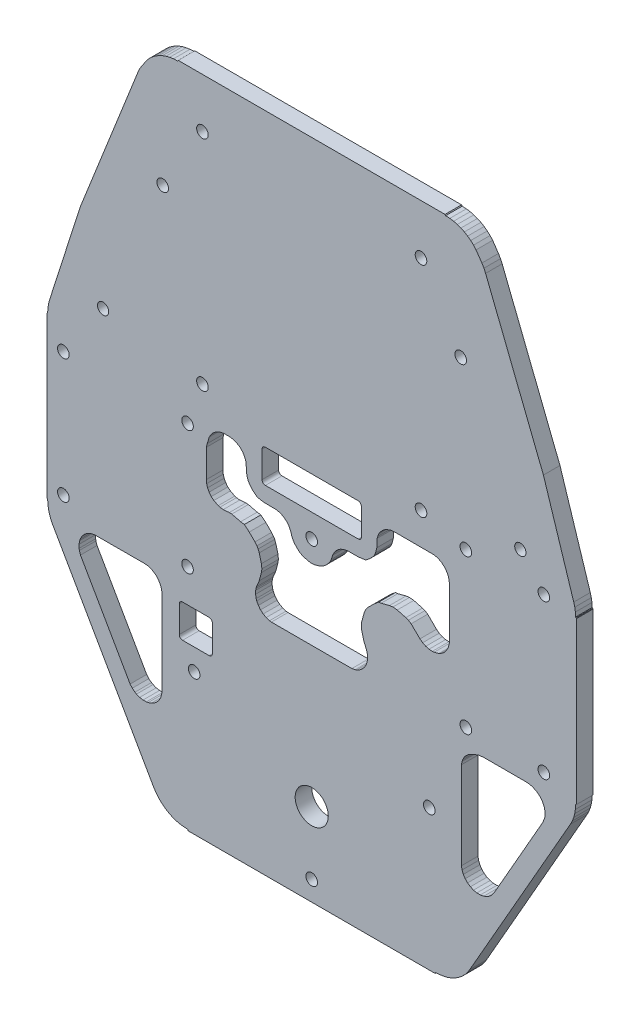
from build123d import *

# Parameters (mm, degrees)
ESQUISSE1_W                                = 200
ESQUISSE1_H                                = 160
ESQUISSE1_R                                = 5
ESQUISSE1_R_2                              = 1.75
ESQUISSE1_W_2                              = 10
ESQUISSE1_H_2                              = 10
ESQUISSE1_H_3                              = 30
BOSS_EXTRU_1_DEPTH                         = 5
CONG_2_R                                   = 1
ENL_V_MAT_EXTRU_1_DEPTH                    = 129.16005618
ESQUISSE3_R                                = 1.75
TROU_CUVE_DIRECTION_DEPTH                  = 129.16005618
ESQUISSE4_R                                = 1.7
POINTE_AVANT_TROUS_BERCEAU_ET_CABLES_DEPTH = 129.16005618
FORME_ARRONDIE_ET_ALLEGEMENT_DEPTH         = 129.16005618


with BuildPart() as part:
    # Esquisse1 → Boss.-Extru.1 (new body)
    with BuildSketch(Plane(origin=(0, 0, 0), x_dir=(0, 1, 0), z_dir=(0, 0, 1))):
        Rectangle(ESQUISSE1_W, ESQUISSE1_H)
        with Locations((-75, 0)):
            Circle(ESQUISSE1_R, mode=Mode.SUBTRACT)
        with Locations((-57.5, 35.5)):
            Circle(ESQUISSE1_R_2, mode=Mode.SUBTRACT)
        with Locations((-57.5, -35.5)):
            Circle(ESQUISSE1_R_2, mode=Mode.SUBTRACT)
        with Locations((65, 45)):
            Circle(ESQUISSE1_R_2, mode=Mode.SUBTRACT)
        with Locations((65, -45)):
            Circle(ESQUISSE1_R_2, mode=Mode.SUBTRACT)
        with Locations((-31, 37.5)):
            Circle(ESQUISSE1_R_2, mode=Mode.SUBTRACT)
        with Locations((-31, 75)):
            Circle(ESQUISSE1_R_2, mode=Mode.SUBTRACT)
        with Locations((6.5, 75)):
            Circle(ESQUISSE1_R_2, mode=Mode.SUBTRACT)
        with Locations((6.5, 37.5)):
            Circle(ESQUISSE1_R_2, mode=Mode.SUBTRACT)
        with Locations((-31, -46.541307377)):
            Circle(ESQUISSE1_R_2, mode=Mode.SUBTRACT)
        with Locations((-31, -70.091307377)):
            Circle(ESQUISSE1_R_2, mode=Mode.SUBTRACT)
        with Locations((15.5, -46.541307377)):
            Circle(ESQUISSE1_R_2, mode=Mode.SUBTRACT)
        with Locations((15.5, -70.091307377)):
            Circle(ESQUISSE1_R_2, mode=Mode.SUBTRACT)
        with Locations((-4.999283545, 0)):
            Circle(ESQUISSE1_R_2, mode=Mode.SUBTRACT)
        with Locations((85, 33)):
            Circle(ESQUISSE1_R_2, mode=Mode.SUBTRACT)
        with Locations((85.001189598, -32.999999989)):
            Circle(ESQUISSE1_R_2, mode=Mode.SUBTRACT)
        with Locations((19, 33)):
            Circle(ESQUISSE1_R_2, mode=Mode.SUBTRACT)
        with Locations((19.001189598, -32.999999989)):
            Circle(ESQUISSE1_R_2, mode=Mode.SUBTRACT)
        with Locations((-46, 35)):
            Rectangle(ESQUISSE1_W_2, ESQUISSE1_H_2, mode=Mode.SUBTRACT)
        with Locations((7, 0)):
            Rectangle(ESQUISSE1_W_2, ESQUISSE1_H_3, mode=Mode.SUBTRACT)
    extrude(amount=BOSS_EXTRU_1_DEPTH)

    # Congé2
    cong_2_edges = [part.edges().sort_by_distance(p)[0] for p in [
        (-30, -51, 2.5),
        (-30, -41, 2.5),
        (-40, -41, 2.5),
        (-40, -51, 2.5),
        (15, 2, 2.5),
        (15, 12, 2.5),
        (-15, 12, 2.5),
        (-15, 2, 2.5),
    ]]
    fillet(cong_2_edges, radius=CONG_2_R)

    # Esquisse2 → Enlèv. mat.-Extru.1 (cut, through all)
    with BuildSketch(Plane.XY.offset(5)):
        Polygon((-573.580399643, 598.167108478), (-698.698151963, -488.082468479), (684.299979338, -647.380682556), (762.904681953, 702.431902078), align=None)
        Polygon((-110, 40), (0, 160), (110, 40), (110, -40), (0, -160), (-110, -40), align=None, mode=Mode.SUBTRACT)
    extrude(amount=-ENL_V_MAT_EXTRU_1_DEPTH, mode=Mode.SUBTRACT)

    # Esquisse3 → Trou cuve direction (cut, through all)
    with BuildSketch(Plane(origin=(0, 0, 0), x_dir=(0, 1, 0), z_dir=(0, 0, 1))):
        with Locations((-94.001515359, 0.004041019)):
            Circle(ESQUISSE3_R)
    extrude(amount=TROU_CUVE_DIRECTION_DEPTH, mode=Mode.SUBTRACT)

    # Esquisse4 → Pointe avant, trous berceau et cables (cut, through all)
    with BuildSketch(Plane.XY.offset(5)):
        with Locations((-63.004041019, 23.738484641)):
            Circle(ESQUISSE4_R)
        with Locations((62.995958981, 23.738484641)):
            Circle(ESQUISSE4_R)
        Polygon((-82.024041019, 47.038484641), (-45.024041019, 103.038484641), (-83.024041019, 103.038484641), (-83.024041019, 47.038484641), align=None)
        Polygon((82.015958981, 47.038484641), (45.015958981, 103.038484641), (83.015958981, 103.038484641), (83.015958981, 47.038484641), align=None)
    extrude(amount=-POINTE_AVANT_TROUS_BERCEAU_ET_CABLES_DEPTH, mode=Mode.SUBTRACT)

    # Esquisse5 → Forme arrondie et allegement (cut, through all)
    with BuildSketch(Plane.XY.offset(5)):
        Polygon((-80.324041019, 14.363484641), (-80.254041019, 14.170484641), (-80.076041019, 14.067484641), (-79.874041019, 14.103484641), (-79.742041019, 14.260484641), (-79.662041019, 15.563484641), (-79.477041019, 16.751484641), (-79.170041019, 17.921484641), (-69.975041019, 46.692484641), (-52.443041019, 90.888484641), (-51.938041019, 91.992484641), (-51.322041019, 93.037484641), (-49.680041019, 95.418484641), (-48.909041019, 96.277484641), (-48.056041019, 97.055484641), (-47.132041019, 97.746484641), (-46.143041019, 98.342484641), (-45.101041019, 98.838484641), (-44.015041019, 99.229484641), (-42.896041019, 99.510484641), (-41.754041019, 99.681484641), (-40.499041019, 99.756484641), (-40.358041019, 99.863484641), (-40.302041019, 100.030484641), (-40.349041019, 100.201484641), (-40.485041019, 100.314484641), (-47.056041019, 100.338484641), (-47.288041019, 100.227484641), (-80.302041019, 50.254484641), align=None)
        Polygon((-80.324041019, -72.688515359), (-80.245041019, -72.891515359), (-55.173041019, -100.222515359), (-37.575041019, -100.261515359), (-37.328041019, -100.131515359), (-37.286041019, -99.882515359), (-37.476041019, -99.678515359), (-39.799041019, -99.447515359), (-40.886041019, -99.182515359), (-41.942041019, -98.815515359), (-42.959041019, -98.348515359), (-43.926041019, -97.787515359), (-44.835041019, -97.136515359), (-45.678041019, -96.401515359), (-46.447041019, -95.588515359), (-47.135041019, -94.706515359), (-47.739041019, -93.757515359), (-78.180041019, -40.448515359), (-78.730041019, -39.358515359), (-79.161041019, -38.223515359), (-79.473041019, -37.050515359), (-79.661041019, -35.852515359), (-79.733041019, -34.565515359), (-79.849041019, -34.396515359), (-80.017041019, -34.340515359), (-80.234041019, -34.425515359), (-80.324041019, -34.640515359), align=None)
        Polygon((54.975958981, -100.261515359), (55.196958981, -100.164515359), (80.255958981, -72.797515359), (80.275958981, -34.710515359), (80.223958981, -34.541515359), (80.085958981, -34.430515359), (79.852958981, -34.436515359), (79.693958981, -34.607515359), (79.612958981, -35.922515359), (79.424958981, -37.120515359), (79.112958981, -38.293515359), (78.681958981, -39.428515359), (78.131958981, -40.518515359), (47.730958981, -93.757515359), (47.126958981, -94.706515359), (46.438958981, -95.588515359), (45.669958981, -96.401515359), (44.826958981, -97.136515359), (43.917958981, -97.787515359), (42.950958981, -98.348515359), (41.933958981, -98.815515359), (40.877958981, -99.182515359), (39.790958981, -99.447515359), (38.684958981, -99.607515359), (37.495958981, -99.670515359), (37.328958981, -99.779515359), (37.266958981, -99.968515359), (37.357958981, -100.176515359), (37.566958981, -100.261515359), align=None)
        Polygon((80.275958981, 50.128484641), (47.231958981, 100.227484641), (46.999958981, 100.338484641), (40.544958981, 100.338484641), (40.352958981, 100.268484641), (40.247958981, 100.001484641), (40.442958981, 99.756484641), (41.697958981, 99.681484641), (42.839958981, 99.510484641), (43.958958981, 99.229484641), (45.044958981, 98.838484641), (46.086958981, 98.342484641), (47.075958981, 97.746484641), (47.999958981, 97.055484641), (48.851958981, 96.277484641), (49.623958981, 95.418484641), (51.385958981, 92.855484641), (52.001958981, 91.809484641), (52.506958981, 90.706484641), (69.966958981, 46.692484641), (79.121958981, 18.047484641), (79.428958981, 16.877484641), (79.613958981, 15.689484641), (79.684958981, 14.414484641), (79.800958981, 14.244484641), (79.968958981, 14.188484641), (80.185958981, 14.273484641), (80.275958981, 14.488484641), align=None)
        Polygon((-12.185041019, -32.836515359), (12.118958981, -32.833515359), (13.123958981, -32.630515359), (13.648958981, -32.439515359), (14.548958981, -31.948515359), (14.993958981, -31.611515359), (15.709958981, -30.877515359), (16.035958981, -30.424515359), (16.503958981, -29.511515359), (16.797958981, -28.467515359), (16.874958981, -27.444515359), (16.832958981, -26.887515359), (16.594958981, -25.859515359), (15.798958981, -23.990515359), (15.100958981, -21.386515359), (14.958958981, -20.345515359), (15.035958981, -19.367515359), (15.895958981, -16.155515359), (16.452958981, -15.063515359), (17.046958981, -14.350515359), (18.778958981, -12.618515359), (20.267958981, -11.381515359), (20.982958981, -11.315515359), (23.487958981, -10.672515359), (24.528958981, -10.529515359), (25.815958981, -10.672515359), (28.418958981, -11.370515359), (29.172958981, -11.655515359), (30.009958981, -12.168515359), (32.686958981, -14.788515359), (33.498958981, -15.403515359), (34.441958981, -15.861515359), (35.427958981, -16.120515359), (36.416958981, -16.186515359), (36.954958981, -16.145515359), (38.397958981, -15.745515359), (38.880958981, -15.504515359), (39.693958981, -14.939515359), (40.087958981, -14.570515359), (40.706958981, -13.796515359), (41.191958981, -12.867515359), (41.474958981, -11.918515359), (41.551958981, -11.384515359), (41.575958981, 4.053484641), (41.470958981, 5.086484641), (41.166958981, 6.080484641), (40.673958981, 6.995484641), (40.012958981, 7.796484641), (39.207958981, 8.453484641), (38.317958981, 8.929484641), (37.323958981, 9.233484641), (36.780958981, 9.314484641), (24.960958981, 9.338484641), (23.927958981, 9.233484641), (22.490958981, 8.719484641), (22.018958981, 8.436484641), (21.217958981, 7.775484641), (20.577958981, 6.995484641), (20.294958981, 6.523484641), (19.908958981, 5.590484641), (19.774958981, 5.057484641), (19.643958981, 2.527484641), (19.266958981, 0.971484641), (18.967958981, 0.298484641), (18.566958981, -0.319515359), (17.524958981, -1.397515359), (16.363958981, -2.335515359), (14.282958981, -2.647515359), (10.726958981, -2.690515359), (9.683958981, -2.906515359), (8.704958981, -3.326515359), (7.829958981, -3.934515359), (7.111958981, -4.681515359), (6.803958981, -5.116515359), (6.324958981, -6.068515359), (5.916958981, -7.402515359), (5.616958981, -8.075515359), (5.060958981, -8.884515359), (4.133958981, -9.835515359), (3.303958981, -10.479515359), (2.417958981, -10.901515359), (0.831958981, -11.326515359), (-0.147041019, -11.403515359), (-1.188041019, -11.261515359), (-2.696041019, -10.813515359), (-3.558041019, -10.345515359), (-4.182041019, -9.835515359), (-5.109041019, -8.884515359), (-5.665041019, -8.075515359), (-5.965041019, -7.402515359), (-6.373041019, -6.068515359), (-6.852041019, -5.116515359), (-7.490041019, -4.301515359), (-7.878041019, -3.934515359), (-8.753041019, -3.326515359), (-9.732041019, -2.906515359), (-10.775041019, -2.690515359), (-14.331041019, -2.647515359), (-16.415041019, -2.318515359), (-17.807041019, -1.186515359), (-18.759041019, -0.120515359), (-19.127041019, 0.517484641), (-19.413041019, 1.271484641), (-19.692041019, 2.527484641), (-19.823041019, 5.057484641), (-20.133041019, 6.080484641), (-20.609041019, 6.970484641), (-20.937041019, 7.411484641), (-21.651041019, 8.125484641), (-22.092041019, 8.453484641), (-23.010041019, 8.940484641), (-24.005041019, 9.239484641), (-25.009041019, 9.338484641), (-26.584041019, 9.315484641), (-27.576041019, 9.126484641), (-28.080041019, 8.951484641), (-28.975041019, 8.486484641), (-29.766041019, 7.859484641), (-30.424041019, 7.093484641), (-30.925041019, 6.217484641), (-31.569041019, 4.137484641), (-31.793041019, 3.084484641), (-31.824041019, -5.400515359), (-31.724041019, -6.411515359), (-31.443041019, -7.358515359), (-30.977041019, -8.260515359), (-30.326041019, -9.078515359), (-29.552041019, -9.736515359), (-28.219041019, -10.407515359), (-27.702041019, -10.553515359), (-26.723041019, -10.682515359), (-24.871041019, -10.529515359), (-24.135041019, -10.568515359), (-21.474041019, -11.234515359), (-20.357041019, -11.401515359), (-18.876041019, -12.618515359), (-17.144041019, -14.350515359), (-16.549041019, -15.063515359), (-16.180041019, -15.701515359), (-15.860041019, -16.573515359), (-15.197041019, -19.059515359), (-15.055041019, -20.345515359), (-15.197041019, -21.386515359), (-15.860041019, -23.872515359), (-16.691041019, -25.859515359), (-16.836041019, -26.367515359), (-16.933041019, -26.917515359), (-16.958041019, -27.942515359), (-16.778041019, -28.982515359), (-16.600041019, -29.511515359), (-16.116041019, -30.449515359), (-15.456041019, -31.272515359), (-14.645041019, -31.948515359), (-13.745041019, -32.439515359), (-12.737041019, -32.753515359), align=None)
        Polygon((48.837958981, -36.941515359), (47.476958981, -37.612515359), (47.046958981, -37.941515359), (46.352958981, -38.652515359), (46.034958981, -39.090515359), (45.572958981, -39.970515359), (45.392958981, -40.480515359), (45.201958981, -41.456515359), (45.199958981, -67.872515359), (45.395958981, -68.881515359), (45.781958981, -69.833515359), (46.345958981, -70.693515359), (47.064958981, -71.428515359), (47.911958981, -72.010515359), (48.855958981, -72.418515359), (49.859958981, -72.636515359), (50.887958981, -72.656515359), (51.927958981, -72.469515359), (53.306958981, -71.852515359), (54.139958981, -71.202515359), (55.070958981, -70.013515359), (69.786958981, -44.243515359), (70.340958981, -42.819515359), (70.436958981, -42.278515359), (70.463958981, -41.267515359), (70.291958981, -40.242515359), (70.120958981, -39.719515359), (69.652958981, -38.790515359), (69.032958981, -37.992515359), (68.634958981, -37.612515359), (67.783958981, -37.014515359), (66.750958981, -36.528515359), (65.819958981, -36.258515359), (64.813958981, -36.161515359), (51.756958981, -36.161515359), (50.305958981, -36.368515359), align=None)
        Polygon((-50.524041019, -36.661515359), (-65.536041019, -36.689515359), (-66.539041019, -36.891515359), (-67.537041019, -37.311515359), (-68.383041019, -37.886515359), (-68.771041019, -38.243515359), (-69.448041019, -39.088515359), (-69.917041019, -39.998515359), (-70.088041019, -40.496515359), (-70.279041019, -41.562515359), (-70.258041019, -42.585515359), (-70.170041019, -43.105515359), (-69.829041019, -44.132515359), (-54.841041019, -70.376515359), (-54.188041019, -71.131515359), (-53.379041019, -71.767515359), (-52.907041019, -72.036515359), (-51.948041019, -72.407515359), (-50.936041019, -72.586515359), (-49.937041019, -72.569515359), (-49.401041019, -72.481515359), (-48.422041019, -72.167515359), (-47.135041019, -71.377515359), (-46.735041019, -71.008515359), (-46.107041019, -70.231515359), (-45.614041019, -69.296515359), (-45.327041019, -68.340515359), (-45.248041019, -67.802515359), (-45.224041019, -41.961515359), (-45.329041019, -40.913515359), (-45.633041019, -39.919515359), (-46.418041019, -38.610515359), (-47.173041019, -37.855515359), (-48.482041019, -37.070515359), (-49.505041019, -36.760515359), align=None)
    extrude(amount=-FORME_ARRONDIE_ET_ALLEGEMENT_DEPTH, mode=Mode.SUBTRACT)


solid = part.part
